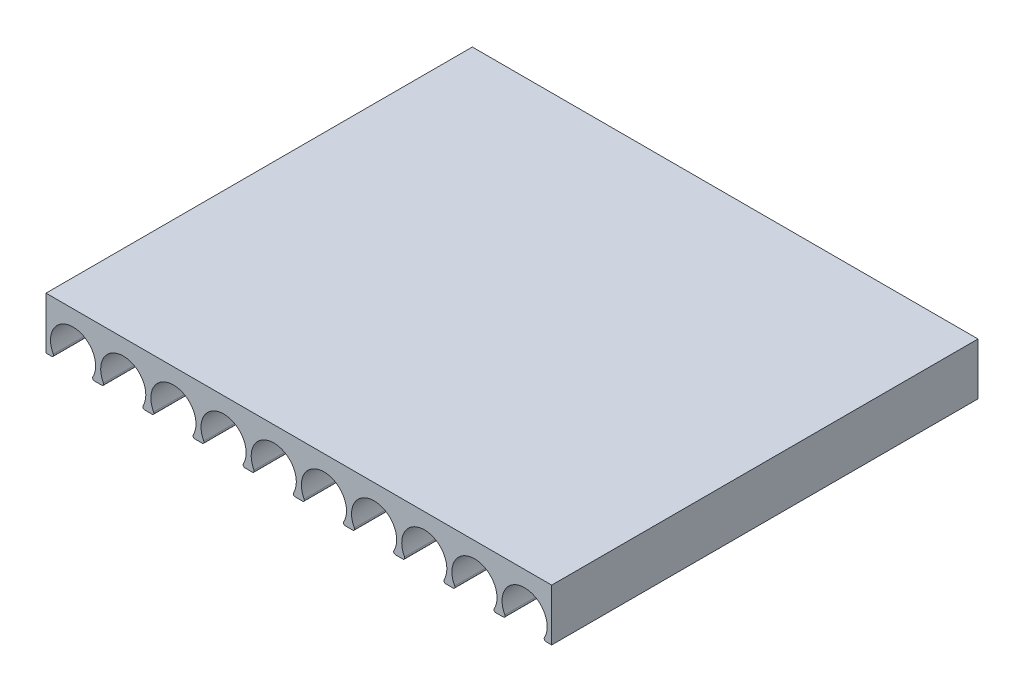
from build123d import *

# Parameters (mm, degrees)
BOSS_EXTRUDE1_DEPTH    = 30
FILLET1_R              = 0.254
LPATTERN1_COUNT        = 10
LPATTERN1_PITCH        = 7.0612
FILLET1_OF_LPATTERN1_R = 0.254
SKETCH4_W              = 71.1708
SKETCH4_H              = 60
BOSS_EXTRUDE2_DEPTH    = 1.5875


with BuildPart() as part:
    # Sketch1 → Boss-Extrude1 (new, symmetric)
    with BuildSketch(Plane.XY):
        with BuildLine():
            Line((0, 0), (1.27, 0))
            ThreePointArc((1.27, 0), (3.81, 5.08), (6.35, 0))
            Line((6.35, 0), (7.62, 0))
            Line((7.62, 0), (7.62, 5.715))
            Line((7.62, 5.715), (0, 5.715))
            Line((0, 5.715), (0, 0))
        make_face()
    boss_extrude1 = extrude(amount=BOSS_EXTRUDE1_DEPTH, both=True)

    # Fillet1
    fillet1_edges = [part.edges().sort_by_distance(p)[0] for p in [
        (1.27, 0, 0),
        (6.35, 0, 0),
    ]]
    fillet(fillet1_edges, radius=FILLET1_R)

    # LPattern1: Boss-Extrude1 ×10
    with Locations(*[(-i * LPATTERN1_PITCH, 0, 0) for i in range(1, LPATTERN1_COUNT)]):
        add(boss_extrude1)

    # Fillet1 of LPattern1
    fillet1_of_lpattern1_edges = [part.edges().sort_by_distance(p)[0] for p in [
        (-5.7912, 0, 0),
        (-0.7112, 0, 0),
        (-12.8524, 0, 0),
        (-7.7724, 0, 0),
        (-19.9136, 0, 0),
        (-14.8336, 0, 0),
        (-26.9748, 0, 0),
        (-21.8948, 0, 0),
        (-34.036, 0, 0),
        (-28.956, 0, 0),
        (-41.0972, 0, 0),
        (-36.0172, 0, 0),
        (-48.1584, 0, 0),
        (-43.0784, 0, 0),
        (-55.2196, 0, 0),
        (-50.1396, 0, 0),
        (-62.2808, 0, 0),
        (-57.2008, 0, 0),
    ]]
    fillet(fillet1_of_lpattern1_edges, radius=FILLET1_OF_LPATTERN1_R)

    # Sketch4 → Boss-Extrude2 (add)
    with BuildSketch(Plane(origin=(0, 5.715, 0), x_dir=(1, 0, 0), z_dir=(0, 1, 0))):
        with Locations((-27.9654, 0)):
            Rectangle(SKETCH4_W, SKETCH4_H)
    extrude(amount=BOSS_EXTRUDE2_DEPTH)


solid = part.part
